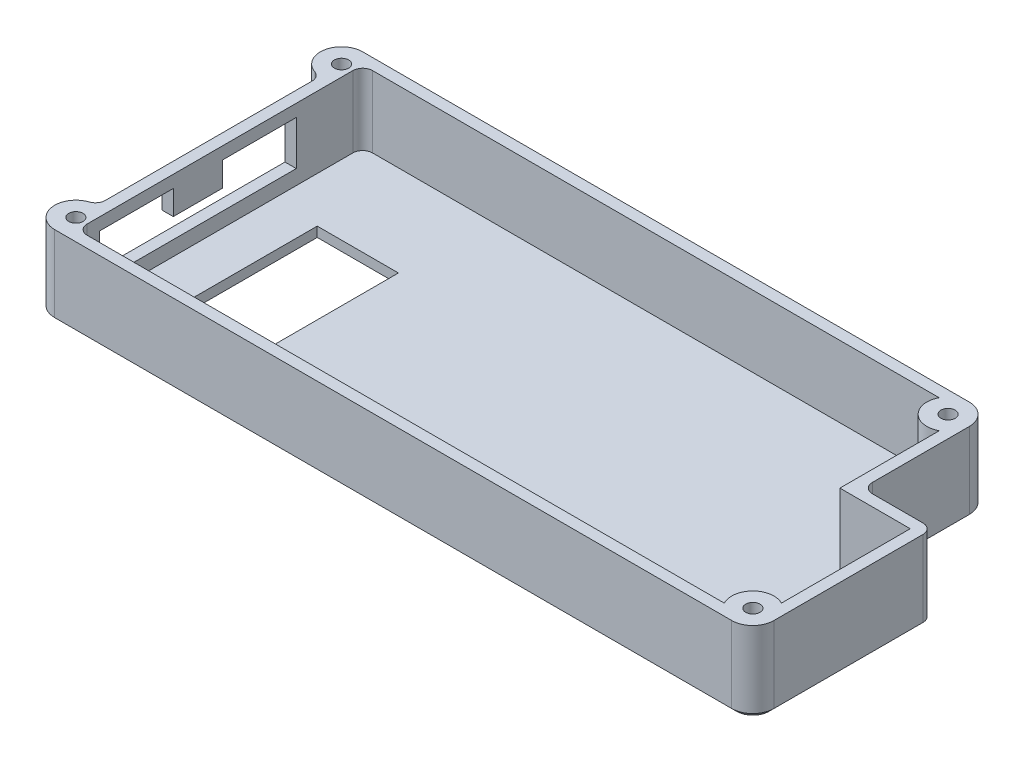
from build123d import *

# Parameters (mm, degrees)
BOSS_EXTRUDE1_DEPTH            = 16.5
BOSS_EXTRUDE2_DEPTH            = 2
FILLET6_R                      = 2
FILLET8_R                      = 2
BOSS_EXTRUDE6_DEPTH            = 16.5
F_2_9_2_9_DIAMETER_HOLE2_D     = 2.9
F_2_9_2_9_DIAMETER_HOLE1_D     = 2.9
SKETCH24_R                     = 4.3
BOSS_EXTRUDE7_DEPTH            = 14.5
F_2_9_2_9_DIAMETER_HOLE3_D     = 2.9
F_2_9_2_9_DIAMETER_HOLE4_D     = 2.9
FILLET10_R                     = 4.3
FILLET16_R                     = 4.3
FILLET17_R                     = 2
FILLET18_R                     = 2
CHAMFER5_SIZE                  = 1
SKETCH29_W                     = 16.5
SKETCH29_H                     = 28.5
CUT_EXTRUDE1_DEPTH             = 10
CUT_EXTRUDE2_REACH             = 148.941
SKETCH30_W                     = 10
SKETCH30_H                     = 4.042033075
SKETCH30_W_2                   = 3.474110813
SKETCH30_H_2                   = 9
CUT_EXTRUDE2_DIRECTION_2_DEPTH = 147.941105233


with BuildPart() as part:
    # Sketch3 → Boss-Extrude1 (new body)
    with BuildSketch(Plane(origin=(0, 0, 0), x_dir=(1, 0, 0), z_dir=(0, 1, 0))):
        Polygon((52.738233838, 8.405993834), (67.038233838, 8.405993834), (67.038233838, -28.194006166), (52.738233838, -28.194006166), (-74.861766162, -28.194006166), (-74.861766162, 34.405993834), (52.738233838, 34.405993834), align=None)
        Polygon((55.038233838, -25.894006166), (64.738233838, -25.894006166), (64.738233838, 6.105993834), (50.438233838, 6.105993834), (50.438233838, 32.105993834), (-72.561766162, 32.105993834), (-72.561766162, -25.894006166), (50.438233838, -25.894006166), align=None, mode=Mode.SUBTRACT)
    extrude(amount=BOSS_EXTRUDE1_DEPTH)

    # Sketch5 → Boss-Extrude2 (add)
    with BuildSketch(Plane(origin=(0, 0, 0), x_dir=(1, 0, 0), z_dir=(0, 1, 0))):
        Polygon((-72.561766162, 32.105993834), (50.438233838, 32.105993834), (50.438233838, 6.105993834), (64.738233838, 6.105993834), (64.738233838, -25.894006166), (50.438233838, -25.894006166), (-72.561766162, -25.894006166), align=None)
    extrude(amount=BOSS_EXTRUDE2_DEPTH)

    # Fillet6
    fillet6_edges = [part.edges().sort_by_distance(p)[0] for p in [
        (50.438233838, 9.25, -32.105993834),
    ]]
    fillet(fillet6_edges, radius=FILLET6_R)

    # Fillet8
    fillet8_edges = [part.edges().sort_by_distance(p)[0] for p in [
        (-72.561766162, 9.25, -32.105993834),
        (-72.561766162, 9.25, 25.894006166),
    ]]
    fillet(fillet8_edges, radius=FILLET8_R)

    # Sketch17 → Boss-Extrude6 (add)
    with BuildSketch(Plane(origin=(0, 0, 0), x_dir=(1, 0, 0), z_dir=(0, 1, 0))):
        with BuildLine():
            Line((-74.861766162, 34.405993834), (-74.861766162, 25.805993834))
            ThreePointArc((-74.861766162, 25.805993834), (-79.161766162, 30.105993834), (-74.861766162, 34.405993834))
        make_face()
        with BuildLine():
            Line((-74.861766162, -19.594006166), (-74.861766162, -28.194006166))
            ThreePointArc((-74.861766162, -28.194006166), (-79.161766162, -23.894006166), (-74.861766162, -19.594006166))
        make_face()
    extrude(amount=BOSS_EXTRUDE6_DEPTH)

    # Ø2.9 (2.9) Diameter Hole2 (through all)
    with Locations(Plane(origin=(0, 16.5, 0), x_dir=(1, 0, 0), z_dir=(0, 1, 0))):
        with Locations((-74.861766162, 30.105993834)):
            Hole(F_2_9_2_9_DIAMETER_HOLE2_D / 2)

    # Ø2.9 (2.9) Diameter Hole1 (through all)
    with Locations(Plane(origin=(0, 16.5, 0), x_dir=(1, 0, 0), z_dir=(0, 1, 0))):
        with Locations((-74.861766162, -23.894006166)):
            Hole(F_2_9_2_9_DIAMETER_HOLE1_D / 2)

    # Sketch24 → Boss-Extrude7 (add)
    with BuildSketch(Plane(origin=(0, 2, 0), x_dir=(1, 0, 0), z_dir=(0, 1, 0))):
        with Locations((62.738431143, -23.885848487)):
            Circle(SKETCH24_R)
        with Locations((48.418494527, 30.105993834)):
            Circle(SKETCH24_R)
    extrude(amount=BOSS_EXTRUDE7_DEPTH)

    # Ø2.9 (2.9) Diameter Hole3 (through all)
    with Locations(Plane(origin=(0, 16.5, 0), x_dir=(1, 0, 0), z_dir=(0, 1, 0))):
        with Locations((62.738431143, -23.885848487)):
            Hole(F_2_9_2_9_DIAMETER_HOLE3_D / 2)

    # Ø2.9 (2.9) Diameter Hole4 (through all)
    with Locations(Plane(origin=(0, 16.5, 0), x_dir=(1, 0, 0), z_dir=(0, 1, 0))):
        with Locations((48.418494527, 30.105993834)):
            Hole(F_2_9_2_9_DIAMETER_HOLE4_D / 2)

    # Fillet10
    fillet10_edges = [part.edges().sort_by_distance(p)[0] for p in [
        (52.738233838, 8.25, -34.405993834),
    ]]
    fillet(fillet10_edges, radius=FILLET10_R)

    # Fillet16
    # the kernel refuses this fillet: 4.3 mm, written as the material it takes off along each edge
    with BuildSketch(Plane(origin=(67.038233838, -10.75, 28.194006166), x_dir=(0, 0, -1), z_dir=(0, 1, 0))) as fillet16_piece_1:
        with BuildLine():
            CenterArc((FILLET16_R, FILLET16_R), FILLET16_R, 180, 90)
            Line((0, FILLET16_R), (0, 0))
            Line((0, 0), (FILLET16_R, 0))
        make_face()
    extrude(amount=38, mode=Mode.SUBTRACT)

    # Fillet17
    fillet17_edges = [part.edges().sort_by_distance(p)[0] for p in [
        (52.738233838, 8.25, -8.405993834),
        (67.038233838, 8.25, -8.405993834),
    ]]
    fillet(fillet17_edges, radius=FILLET17_R)

    # Fillet18
    fillet18_edges = [part.edges().sort_by_distance(p)[0] for p in [
        (-74.861766162, 8.25, -25.805993834),
        (-74.861766162, 8.25, 19.594006166),
    ]]
    fillet(fillet18_edges, radius=FILLET18_R)

    # Chamfer5
    chamfer5_edges = [part.edges().sort_by_distance(p)[0] for p in [
        (-13.211766162, 0, -34.405993834),
        (51.478792997, 0, -33.146552993),
        (67.038233838, 0, 8.744006166),
        (65.778792997, 0, 26.934565325),
        (52.738233838, 0, -20.255993834),
        (59.888233838, 0, -8.405993834),
        (66.4524474, 0, -7.820207397),
        (53.324020275, 0, -8.991780272),
        (-79.105793795, 0, 24.585547524),
        (-74.861766162, 0, -3.105993834),
        (-75.2385223, 0, 19.088261462),
        (-75.2385223, 0, -25.300249131),
        (-6.061766162, 0, 28.194006166),
        (-79.105793795, 0, -30.797535193),
    ]]
    chamfer(chamfer5_edges, length=CHAMFER5_SIZE)

    # Sketch29 → Cut-Extrude1 (cut)
    with BuildSketch(Plane(origin=(0, 2, 0), x_dir=(1, 0, 0), z_dir=(0, 1, 0))):
        with Locations((-55.053624673, -0.644006166)):
            Rectangle(SKETCH29_W, SKETCH29_H)
    extrude(amount=-CUT_EXTRUDE1_DEPTH, mode=Mode.SUBTRACT)

    # Sketch30 → Cut-Extrude2 (cut, up to next)
    with BuildSketch(Plane.ZY.offset(74.861766162), mode=Mode.PRIVATE) as cut_extrude2_sk1:
        with Locations((1.394006166, 7.021016538)):
            Rectangle(SKETCH30_W, SKETCH30_H)
    cut_extrude2_tool1 = extrude(cut_extrude2_sk1.sketch, amount=-CUT_EXTRUDE2_REACH, mode=Mode.PRIVATE) & part.part
    # Sketch30 → Cut-Extrude2 (cut, up to next)
    with BuildSketch(Plane.ZY.offset(74.861766162), mode=Mode.PRIVATE) as cut_extrude2_sk2:
        Polygon((-3.605993834, 5), (-3.605993834, 9.042033075), (-3.605993834, 14), (-18.605993834, 14), (-18.605993834, 5), align=None)
    cut_extrude2_tool2 = extrude(cut_extrude2_sk2.sketch, amount=-CUT_EXTRUDE2_REACH, mode=Mode.PRIVATE) & part.part
    # Sketch30 → Cut-Extrude2 (cut, up to next)
    with BuildSketch(Plane.ZY.offset(74.861766162), mode=Mode.PRIVATE) as cut_extrude2_sk3:
        Polygon((6.394006166, 14), (6.394006166, 9.042033075), (6.394006166, 5), (17.919895353, 5), (17.919895353, 14), align=None)
    cut_extrude2_tool3 = extrude(cut_extrude2_sk3.sketch, amount=-CUT_EXTRUDE2_REACH, mode=Mode.PRIVATE) & part.part
    # Sketch30 → Cut-Extrude2 (cut, up to next)
    with BuildSketch(Plane.ZY.offset(74.861766162), mode=Mode.PRIVATE) as cut_extrude2_sk4:
        with Locations((19.656950759, 9.5)):
            Rectangle(SKETCH30_W_2, SKETCH30_H_2)
    cut_extrude2_tool4 = extrude(cut_extrude2_sk4.sketch, amount=-CUT_EXTRUDE2_REACH, mode=Mode.PRIVATE) & part.part
    add(cut_extrude2_tool1.solids().sort_by_distance((-74.861766, 7.021017, 1.394006))[0], mode=Mode.SUBTRACT)
    add(cut_extrude2_tool2.solids().sort_by_distance((-74.861766, 9.5, -11.105994))[0], mode=Mode.SUBTRACT)
    add(cut_extrude2_tool3.solids().sort_by_distance((-74.861766, 9.5, 12.156951))[0], mode=Mode.SUBTRACT)
    add(cut_extrude2_tool4.solids().sort_by_distance((-74.861766, 9.5, 19.656951))[0], mode=Mode.SUBTRACT)

    # Sketch30 → Cut-Extrude2 direction 2 (cut)
    with BuildSketch(Plane.ZY.offset(74.861766162)):
        with Locations((1.394006166, 7.021016538)):
            Rectangle(SKETCH30_W, SKETCH30_H)
        Polygon((-3.605993834, 5), (-3.605993834, 9.042033075), (-3.605993834, 14), (-18.605993834, 14), (-18.605993834, 5), align=None)
        Polygon((6.394006166, 14), (6.394006166, 9.042033075), (6.394006166, 5), (17.919895353, 5), (17.919895353, 14), align=None)
        with Locations((19.656950759, 9.5)):
            Rectangle(SKETCH30_W_2, SKETCH30_H_2)
    extrude(amount=CUT_EXTRUDE2_DIRECTION_2_DEPTH, mode=Mode.SUBTRACT)


solid = part.part
